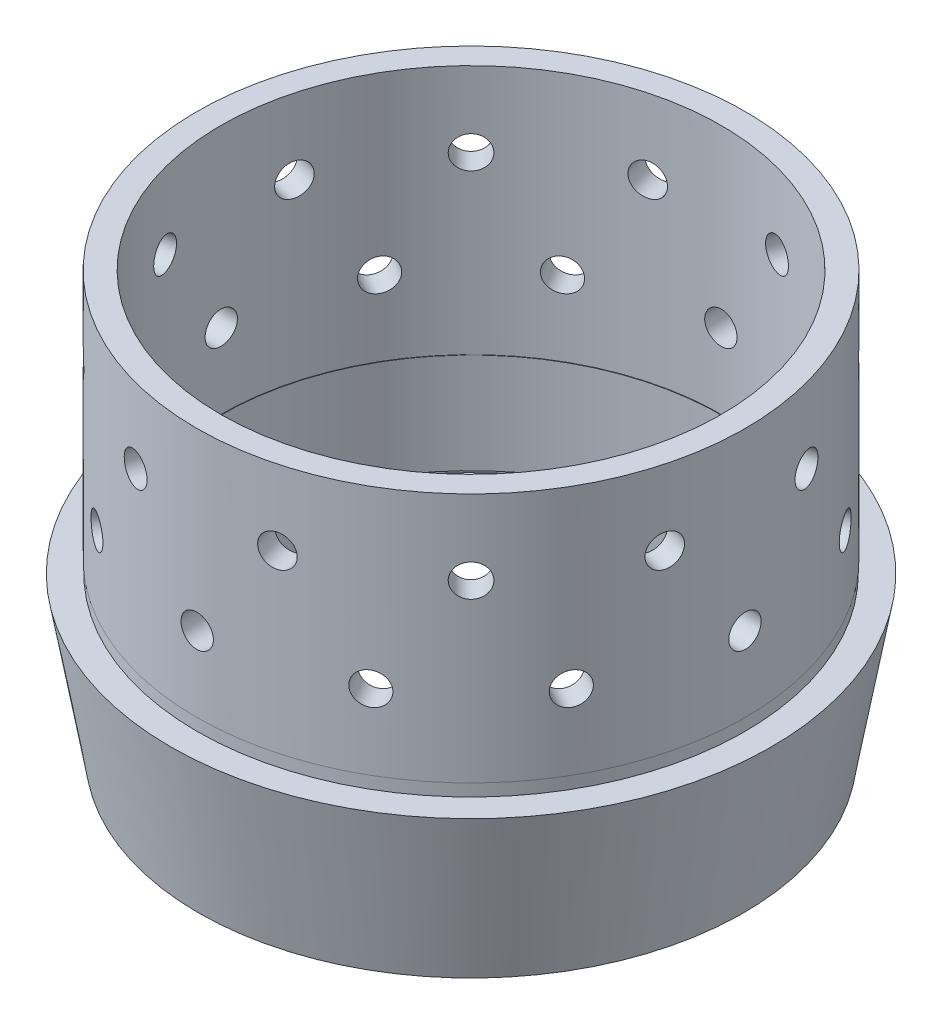
from build123d import *

# Parameters (mm, degrees)
SKETCH1_R           = 69.596
SKETCH1_R_2         = 63.5
BOSS_EXTRUDE1_DEPTH = 63.5
CUT_EXTRUDE1_REACH  = 170.078
SKETCH2_R           = 4.1021
CIRPATTERN1_COUNT   = 12
CUT_EXTRUDE2_REACH  = 176.435
SKETCH3_R           = 4.1021
CIRPATTERN2_COUNT   = 12


with BuildPart() as part:
    # Sketch1 → Boss-Extrude1 (new body)
    with BuildSketch(Plane(origin=(0, 0, 0), x_dir=(1, 0, 0), z_dir=(0, 1, 0))):
        Circle(SKETCH1_R)
        Circle(SKETCH1_R_2, mode=Mode.SUBTRACT)
    extrude(amount=BOSS_EXTRUDE1_DEPTH)

    # Sketch2 → Cut-Extrude1 (cut, up to next)
    with BuildSketch(Plane.XY.offset(69.596), mode=Mode.PRIVATE) as cut_extrude1_sk1:
        with Locations((0, 19.05)):
            Circle(SKETCH2_R)
    cut_extrude1_tool1 = extrude(cut_extrude1_sk1.sketch, amount=-CUT_EXTRUDE1_REACH, mode=Mode.PRIVATE) & part.part
    cut_extrude1 = cut_extrude1_tool1.solids().sort_by_distance((0, 19.05, 69.596))[0]
    add(cut_extrude1, mode=Mode.SUBTRACT)

    # CirPattern1: Cut-Extrude1 ×12 about axis
    cirpattern1_axis = Axis((0, 63.5, 0), (0, -1, 0))
    for i in range(1, CIRPATTERN1_COUNT):
        add(cut_extrude1.rotate(cirpattern1_axis, i * 360 / CIRPATTERN1_COUNT), mode=Mode.SUBTRACT)

    # Sketch3 → Cut-Extrude2 (cut, up to next)
    with BuildSketch(Plane(origin=(-18.012770263, 0, 67.224573806), x_dir=(0, -1, 0), z_dir=(-0.25881904510252135, 0, 0.9659258262890681)), mode=Mode.PRIVATE) as cut_extrude2_sk1:
        with Locations((-44.45, 0)):
            Circle(SKETCH3_R)
    cut_extrude2_tool1 = extrude(cut_extrude2_sk1.sketch, amount=-CUT_EXTRUDE2_REACH, mode=Mode.PRIVATE) & part.part
    cut_extrude2 = cut_extrude2_tool1.solids().sort_by_distance((-18.01277, 44.45, 67.224574))[0]
    add(cut_extrude2, mode=Mode.SUBTRACT)

    # CirPattern2: Cut-Extrude2 ×12 about axis
    cirpattern2_axis = Axis((0, 63.5, 0), (0, -1, 0))
    for i in range(1, CIRPATTERN2_COUNT):
        add(cut_extrude2.rotate(cirpattern2_axis, i * 360 / CIRPATTERN2_COUNT), mode=Mode.SUBTRACT)

    # Sketch4 → Revolve1 (revolve)
    with BuildSketch(Plane(origin=(0, 0, 0), x_dir=(0.9135454576425946, 0, 0.4067366430758145), z_dir=(-0.4067366430758145, 0, 0.9135454576425946))):
        Polygon((-63.373, 0), (-69.469, 0), (-69.469, -3.175), (-76.2, -3.175), (-69.146039137, -43.18), (-63.373, -43.18), (-63.373, -31.749123985), (-63.373, -28.1686), (-66.675, -28.1686), (-66.675, -25.4), (-63.373, -25.4), align=None)
    revolve(axis=Axis((0, 63.5, 0), (0, -1, 0)))


solid = part.part
